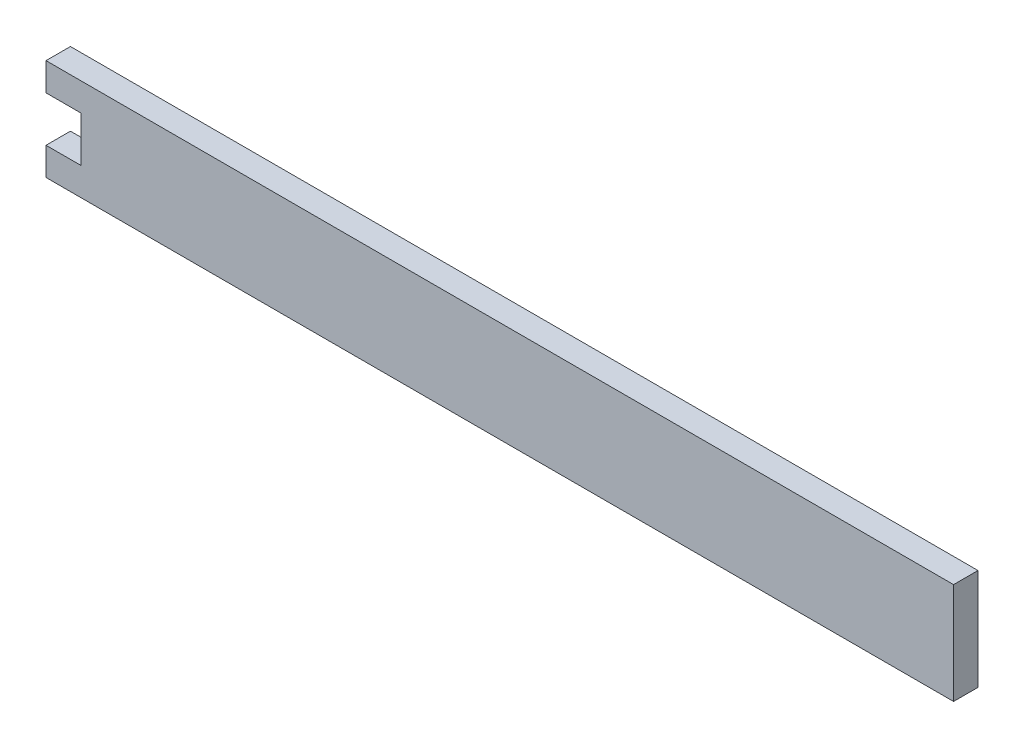
from build123d import *

# Parameters (mm, degrees)
CROQUIS1_W              = 1300
CROQUIS1_H              = 145
SALIENTE_EXTRUIR1_DEPTH = 35
SKETCH1_W               = 35
SKETCH1_H               = 65
CUT_EXTRUDE1_DEPTH      = 50


with BuildPart() as part:
    # Croquis1 → Saliente-Extruir1 (new body)
    with BuildSketch(Plane.XY):
        Rectangle(CROQUIS1_W, CROQUIS1_H)
    extrude(amount=SALIENTE_EXTRUIR1_DEPTH)

    # Sketch1 → Cut-Extrude1 (cut)
    with BuildSketch(Plane.ZY.offset(650)):
        with Locations((17.5, 0)):
            Rectangle(SKETCH1_W, SKETCH1_H)
    extrude(amount=-CUT_EXTRUDE1_DEPTH, mode=Mode.SUBTRACT)


solid = part.part
